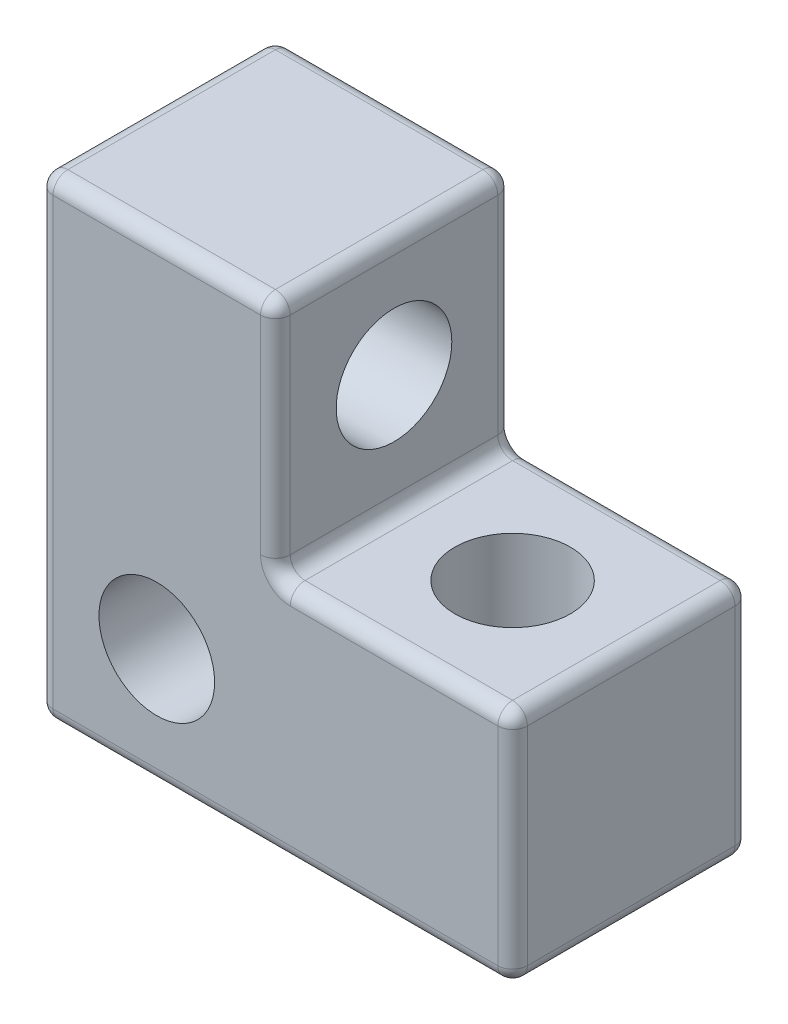
from build123d import *

# Parameters (mm, degrees)
BOSS_EXTRUDE1_DEPTH                      = 8
F_3_9_3_9_DIAMETER_HOLE1_D               = 3.9
F_3_9_3_9_DIAMETER_HOLE1_DEPTH           = 6
F_3_9_3_9_DIAMETER_HOLE1_TIP             = 1.95
F_3_9_3_9_DIAMETER_HOLE1_ON_FACE_2_D     = 3.9
F_3_9_3_9_DIAMETER_HOLE1_ON_FACE_2_DEPTH = 6
F_3_9_3_9_DIAMETER_HOLE1_ON_FACE_2_TIP   = 1.95
F_3_9_3_9_DIAMETER_HOLE1_ON_FACE_3_D     = 3.9
F_3_9_3_9_DIAMETER_HOLE1_ON_FACE_3_DEPTH = 6
F_3_9_3_9_DIAMETER_HOLE1_ON_FACE_3_TIP   = 1.95
F_3_4_START                              = -8
F_3_4_3_4_DIAMETER_HOLE1_OUTLINE_R       = 1.7
F_3_4_3_4_DIAMETER_HOLE1_DEPTH           = 1.7500001
F_3_4_3_4_DIAMETER_HOLE1_2_OUTLINE_R     = 1.7
F_3_4_3_4_DIAMETER_HOLE1_2_DEPTH         = 1.7500001
F_3_4_3_4_DIAMETER_HOLE1_3_OUTLINE_R     = 1.7
F_3_4_3_4_DIAMETER_HOLE1_3_DEPTH         = 1.7500001
FILLET1_R                                = 0.5


# Read off the part's stored shape, not the designer's step: Ø3.4 (3.4) Diameter Hole1
with BuildPart() as part:
    # Sketch1 → Boss-Extrude1 (new body)
    with BuildSketch(Plane.XY):
        Polygon((0, 0), (0, 8), (-8, 8), (-8, -8), (8, -8), (8, 0), align=None)
    extrude(amount=BOSS_EXTRUDE1_DEPTH)

    # Ø3.9 (3.9) Diameter Hole1
    with Locations(Plane(origin=(-4, -4, 8), x_dir=(1, 0, 0), z_dir=(0, 0, 1))):
        with Locations((0, 0)):
            Hole(F_3_9_3_9_DIAMETER_HOLE1_D / 2, depth=F_3_9_3_9_DIAMETER_HOLE1_DEPTH)
            with Locations((0, 0, -(F_3_9_3_9_DIAMETER_HOLE1_DEPTH + F_3_9_3_9_DIAMETER_HOLE1_TIP / 2))):  # 90° drill point
                Cone(0, F_3_9_3_9_DIAMETER_HOLE1_D / 2, F_3_9_3_9_DIAMETER_HOLE1_TIP, mode=Mode.SUBTRACT)

    # Ø3.9 (3.9) Diameter Hole1 on face 2
    with Locations(Plane(origin=(0, 4, 4), x_dir=(0, 0, 1), z_dir=(1, 0, 0))):
        with Locations((0, 0)):
            Hole(F_3_9_3_9_DIAMETER_HOLE1_ON_FACE_2_D / 2, depth=F_3_9_3_9_DIAMETER_HOLE1_ON_FACE_2_DEPTH)
            with Locations((0, 0, -(F_3_9_3_9_DIAMETER_HOLE1_ON_FACE_2_DEPTH + F_3_9_3_9_DIAMETER_HOLE1_ON_FACE_2_TIP / 2))):  # 90° drill point
                Cone(0, F_3_9_3_9_DIAMETER_HOLE1_ON_FACE_2_D / 2, F_3_9_3_9_DIAMETER_HOLE1_ON_FACE_2_TIP, mode=Mode.SUBTRACT)

    # Ø3.9 (3.9) Diameter Hole1 on face 3
    with Locations(Plane(origin=(4, 0, 4), x_dir=(0, 0, 1), z_dir=(0, 1, 0))):
        with Locations((0, 0)):
            Hole(F_3_9_3_9_DIAMETER_HOLE1_ON_FACE_3_D / 2, depth=F_3_9_3_9_DIAMETER_HOLE1_ON_FACE_3_DEPTH)
            with Locations((0, 0, -(F_3_9_3_9_DIAMETER_HOLE1_ON_FACE_3_DEPTH + F_3_9_3_9_DIAMETER_HOLE1_ON_FACE_3_TIP / 2))):  # 90° drill point
                Cone(0, F_3_9_3_9_DIAMETER_HOLE1_ON_FACE_3_D / 2, F_3_9_3_9_DIAMETER_HOLE1_ON_FACE_3_TIP, mode=Mode.SUBTRACT)

    # Ø3.4 (3.4) Diameter Hole1 outline → Ø3.4 (3.4) Diameter Hole1 (cut)
    with BuildSketch(Plane(origin=(0, 0, 0), x_dir=(1, 0, 0), z_dir=(0, 1, 0)).offset(F_3_4_START)):
        with Locations((4, -4)):
            Circle(F_3_4_3_4_DIAMETER_HOLE1_OUTLINE_R)
    extrude(amount=F_3_4_3_4_DIAMETER_HOLE1_DEPTH, mode=Mode.SUBTRACT)

    # 3.4 _3.4_ Diameter Hole1 2 outline → 3.4 _3.4_ Diameter Hole1 2 (cut)
    with BuildSketch(Plane.YZ.offset(F_3_4_START)):
        with Locations((4, 4)):
            Circle(F_3_4_3_4_DIAMETER_HOLE1_2_OUTLINE_R)
    extrude(amount=F_3_4_3_4_DIAMETER_HOLE1_2_DEPTH, mode=Mode.SUBTRACT)

    # 3.4 _3.4_ Diameter Hole1 3 outline → 3.4 _3.4_ Diameter Hole1 3 (cut)
    with BuildSketch(Plane.XY):
        with Locations((-4, -4)):
            Circle(F_3_4_3_4_DIAMETER_HOLE1_3_OUTLINE_R)
    extrude(amount=F_3_4_3_4_DIAMETER_HOLE1_3_DEPTH, mode=Mode.SUBTRACT)

    # Fillet1
    fillet1_edges = [part.edges().sort_by_distance(p)[0] for p in [
        (8, 0, 4),
        (8, -8, 4),
        (-8, -8, 4),
        (-8, 8, 4),
        (0, 8, 4),
        (0, 0, 4),
        (-4, 8, 8),
        (-8, 0, 8),
        (0, -8, 8),
        (8, -4, 8),
        (4, 0, 8),
        (8, -4, 0),
        (0, -8, 0),
        (-8, 0, 0),
        (-4, 8, 0),
        (0, 4, 0),
        (4, 0, 0),
        (0, 4, 8),
    ]]
    fillet(fillet1_edges, radius=FILLET1_R)


solid = part.part
